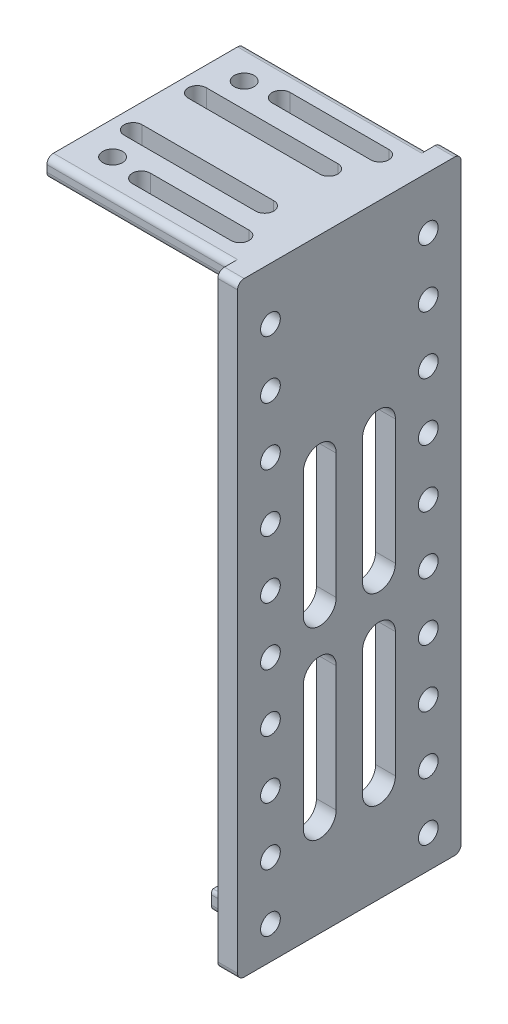
from build123d import *

# Parameters (mm, degrees)
SKETCH_1_W          = 3
SKETCH_1_H          = 34
EXTRUDE_1_DEPTH     = 92
SKETCH_2_W          = 8
SKETCH_2_H          = 20
SKETCH_2_R          = 1.5
EXTRUDE_2_DEPTH     = 3
SKETCH_10_W         = 28
SKETCH_10_H         = 30
SKETCH_10_R         = 1.5
EXTRUDE_6_DEPTH     = 3
EXTRUDE_7_DEPTH     = 1.5
CHAMFER_3_SIZE      = 3
SKETCH_9_R          = 1.5
CUT_EXTRUDE_2_DEPTH = 3
CHAMFER_4_SIZE      = 8
SKETCH_12_R         = 3
CUT_EXTRUDE_3_DEPTH = 17
CUT_EXTRUDE_START   = -3
SKETCH_13_R         = 3
CUT_EXTRUDE_4_DEPTH = 17
FILLET_1_R          = 1
CUT_EXTRUDE_5_DEPTH = 10
CUT_EXTRUDE_6_DEPTH = 10


# Some blends are built 0.0001 mm under size
with BuildPart() as part:
    # 草图1 → 凸台-拉伸1 (new body)
    with BuildSketch(Plane(origin=(0, 0, 0), x_dir=(1, 0, 0), z_dir=(0, 1, 0))):
        with Locations((-10.5, 0)):
            Rectangle(SKETCH_1_W, SKETCH_1_H)
    extrude(amount=EXTRUDE_1_DEPTH)

    # 草图2 → 凸台-拉伸2 (add)
    with BuildSketch(Plane.XZ):
        with Locations((-16, 0)):
            Rectangle(SKETCH_2_W, SKETCH_2_H)
        with Locations(Location((-16, 5, 0), (0, 0, 270))):
            Circle(SKETCH_2_R, mode=Mode.SUBTRACT)
        with Locations(Location((-16, -5, 0), (0, 0, 270))):
            Circle(SKETCH_2_R, mode=Mode.SUBTRACT)
    extrude(amount=-EXTRUDE_2_DEPTH)

    # 草图10 → 凸台-拉伸6 (add)
    with BuildSketch(Plane(origin=(0, 92, 0), x_dir=(1, 0, 0), z_dir=(0, 1, 0))):
        with Locations((-26, 0)):
            Rectangle(SKETCH_10_W, SKETCH_10_H)
        with Locations(Location((-35, 10, 0), (0, 0, 270))):
            Circle(SKETCH_10_R, mode=Mode.SUBTRACT)
        with Locations(Location((-35, -10, 0), (0, 0, 270))):
            Circle(SKETCH_10_R, mode=Mode.SUBTRACT)
    extrude(amount=-EXTRUDE_6_DEPTH)

    # 草图11 → 凸台-拉伸7 (add, symmetric)
    with BuildSketch(Plane.XY):
        Polygon((-12, 69), (-12, 89), (-27, 89), (-15, 69), align=None)
    extrude(amount=EXTRUDE_7_DEPTH, both=True)

    # 倒角3
    chamfer_3_edges = [part.edges().sort_by_distance(p)[0] for p in [
        (-12, 79, -1.5),
        (-12, 69, 0),
        (-12, 79, 1.5),
    ]]
    chamfer(chamfer_3_edges, length=CHAMFER_3_SIZE - 0.0001)  # a hair under: the kernel refuses the full size

    # 草图9 → 切除-拉伸2 (cut)
    with BuildSketch(Plane.ZY.offset(12)):
        with Locations((12, 5)):
            Circle(SKETCH_9_R)
        with Locations((12, 13.777777778)):
            Circle(SKETCH_9_R)
        with Locations((12, 22.555555556)):
            Circle(SKETCH_9_R)
        with Locations((12, 31.333333333)):
            Circle(SKETCH_9_R)
        with Locations((12, 40.111111111)):
            Circle(SKETCH_9_R)
        with Locations((12, 48.888888889)):
            Circle(SKETCH_9_R)
        with Locations((12, 57.666666667)):
            Circle(SKETCH_9_R)
        with Locations((12, 66.444444444)):
            Circle(SKETCH_9_R)
        with Locations((12, 75.222222222)):
            Circle(SKETCH_9_R)
        with Locations((12, 84)):
            Circle(SKETCH_9_R)
        with Locations(Location((-12, 84, 0), (0, 0, 180))):
            Circle(SKETCH_9_R)
        with Locations(Location((-12, 75.222222222, 0), (0, 0, 180))):
            Circle(SKETCH_9_R)
        with Locations(Location((-12, 66.444444444, 0), (0, 0, 180))):
            Circle(SKETCH_9_R)
        with Locations(Location((-12, 57.666666667, 0), (0, 0, 180))):
            Circle(SKETCH_9_R)
        with Locations(Location((-12, 48.888888889, 0), (0, 0, 180))):
            Circle(SKETCH_9_R)
        with Locations(Location((-12, 40.111111111, 0), (0, 0, 180))):
            Circle(SKETCH_9_R)
        with Locations(Location((-12, 31.333333333, 0), (0, 0, 180))):
            Circle(SKETCH_9_R)
        with Locations(Location((-12, 22.555555556, 0), (0, 0, 180))):
            Circle(SKETCH_9_R)
        with Locations(Location((-12, 13.777777778, 0), (0, 0, 180))):
            Circle(SKETCH_9_R)
        with Locations(Location((-12, 5, 0), (0, 0, 180))):
            Circle(SKETCH_9_R)
    extrude(amount=-CUT_EXTRUDE_2_DEPTH, mode=Mode.SUBTRACT)

    # 倒角4
    # the kernel refuses this chamfer: 8 mm, written as the material it adds along each edge
    with BuildSketch(Plane(origin=(-12, 3, 10), x_dir=(0.027495876610586494, 0.9996219169112968, 0), z_dir=(0, 0, -1))) as chamfer_4_piece_1_section:
        Polygon((CHAMFER_4_SIZE * 0.999621916911, -CHAMFER_4_SIZE * 0.0274958766106), (-CHAMFER_4_SIZE * 0.0274958766106, -CHAMFER_4_SIZE * 0.999621916911), (0, 0), align=None)
    chamfer_4_piece_1 = extrude(amount=20, mode=Mode.PRIVATE)
    chamfer_4_piece_1 = split(chamfer_4_piece_1, bisect_by=Plane(origin=(-20, 5.703132101, -1.264e-06), z_dir=(1, 0, 0)), keep=Keep.TOP, mode=Mode.PRIVATE)
    chamfer_4_piece_1 = chamfer_4_piece_1 - Plane(origin=(-16, 5.703132101, 5), x_dir=(0, 0, -1), z_dir=(0, -1, 0)) * Cylinder(1.5, 72, mode=Mode.PRIVATE)
    chamfer_4_piece_1 = chamfer_4_piece_1 - Plane(origin=(-16, 5.703132101, -5), x_dir=(0, 0, -1), z_dir=(0, -1, 0)) * Cylinder(1.5, 72, mode=Mode.PRIVATE)
    add(chamfer_4_piece_1)

    # 草图12 → 切除-拉伸3 (cut)
    with BuildSketch(Plane.ZY.offset(12)):
        with Locations((-12, 5)):
            Circle(SKETCH_12_R)
        with Locations((12, 5)):
            Circle(SKETCH_12_R)
    extrude(amount=CUT_EXTRUDE_3_DEPTH, mode=Mode.SUBTRACT)

    # 草图13 → 切除-拉伸4 (cut)
    with BuildSketch(Plane.XZ.offset(CUT_EXTRUDE_START)):
        with Locations(Location((-16, 5, 0), (0, 0, 270))):
            Circle(SKETCH_13_R)
        with Locations(Location((-16, -5, 0), (0, 0, 270))):
            Circle(SKETCH_13_R)
    extrude(amount=-CUT_EXTRUDE_4_DEPTH, mode=Mode.SUBTRACT)

    # 圆角1
    # the kernel refuses this fillet: 1 mm, written as the material it adds along each edge
    with BuildSketch(Plane(origin=(-10.232233047, 89, -6.267666953), x_dir=(-0.7071067811865476, 0, -0.7071067811865476), z_dir=(-0.7071067811865476, 0, 0.7071067811865476)), Plane(origin=(-10.232233047, 89, 6.267666953), x_dir=(0, -1, 0), z_dir=(-0.7071067811865476, 0, -0.7071067811865476))) as fillet_1_piece_1:
        with BuildLine():
            CenterArc((FILLET_1_R, FILLET_1_R), FILLET_1_R, 180, 90)
            Line((0, FILLET_1_R), (0, 0))
            Line((0, 0), (FILLET_1_R, 0))
        make_face()
    extrude(amount=9.242499266)
    # the kernel refuses this fillet: 1 mm, written as the material it takes off along each edge
    with BuildSketch(Plane(origin=(-12, 0, -10), x_dir=(0, 0, 1), z_dir=(-1, 0, 0)), Plane(origin=(-22.5, 0, 10), x_dir=(0, 0, -1), z_dir=(1, 0, 0))) as fillet_1_2_piece_1:
        with BuildLine():
            CenterArc((FILLET_1_R, FILLET_1_R), FILLET_1_R, 180, 90)
            Line((0, FILLET_1_R), (0, 0))
            Line((0, 0), (FILLET_1_R, 0))
        make_face()
    extrude(amount=10.5, mode=Mode.SUBTRACT)
    with BuildSketch(Plane(origin=(-6.5, 0, -17), x_dir=(0, 1, 0), z_dir=(-1, 0, 0)), Plane(origin=(-6.5, 92, -17), x_dir=(0, 0, 1), z_dir=(-1, 0, 0)), Plane(origin=(-14.5, 92, 17), x_dir=(0, 0, -1), z_dir=(1, 0, 0))) as fillet_1_2_piece_2:
        with BuildLine():
            CenterArc((FILLET_1_R, -FILLET_1_R), FILLET_1_R, 90, 90)
            Line((0, -FILLET_1_R), (0, 0))
            Line((0, 0), (FILLET_1_R, 0))
        make_face()
    extrude(amount=8, mode=Mode.SUBTRACT)
    with BuildSketch(Plane(origin=(-12, 92, -15), x_dir=(0, -1, 0), z_dir=(-1, 0, 0)), Plane(origin=(-12, 89, -15), x_dir=(0, 0, 1), z_dir=(-1, 0, 0)), Plane(origin=(-42.5, 89, 15), x_dir=(0, 0, -1), z_dir=(1, 0, 0))) as fillet_1_2_piece_3:
        with BuildLine():
            CenterArc((FILLET_1_R, FILLET_1_R), FILLET_1_R, 180, 90)
            Line((0, FILLET_1_R), (0, 0))
            Line((0, 0), (FILLET_1_R, 0))
        make_face()
    extrude(amount=30.5, mode=Mode.SUBTRACT)
    with BuildSketch(Plane(origin=(-11.166666667, 65.166766667, -5.333233333), x_dir=(0.4082482904638647, -0.4082482904638616, 0.8164965809277258), z_dir=(-0.5773502691896261, 0.5773502691896254, 0.5773502691896261))) as fillet_1_2_piece_4_section:
        with BuildLine():
            CenterArc((FILLET_1_R * 0.57735026919, FILLET_1_R), FILLET_1_R, 210, 60)
            Line((-FILLET_1_R * 0.288675134595, FILLET_1_R * 0.5), (0, 0))
            Line((0, 0), (FILLET_1_R * 0.57735026919, 0))
        make_face()
    fillet_1_2_piece_4 = extrude(amount=8.082730564, mode=Mode.PRIVATE)
    fillet_1_2_piece_4 = split(fillet_1_2_piece_4, bisect_by=Plane(origin=(-12, 67.52905753, -2.97094247), z_dir=(-1, 0, 0)), keep=Keep.TOP, mode=Mode.PRIVATE)
    fillet_1_2_piece_4 = split(fillet_1_2_piece_4, bisect_by=Plane(origin=(-13.382960945, 67.52905753, -1.5), z_dir=(0, 0, -1)), keep=Keep.TOP, mode=Mode.PRIVATE)
    add(fillet_1_2_piece_4, mode=Mode.SUBTRACT)
    with BuildSketch(Plane(origin=(-11.166666667, 65.166766667, 5.333233333), x_dir=(0.40824829046386624, -0.4082482904638601, -0.8164965809277258), z_dir=(-0.5773502691896261, 0.5773502691896254, -0.5773502691896261))) as fillet_1_2_piece_5_section:
        with BuildLine():
            CenterArc((FILLET_1_R * 0.57735026919, -FILLET_1_R), FILLET_1_R, 90, 60)
            Line((-FILLET_1_R * 0.288675134595, -FILLET_1_R * 0.5), (0, 0))
            Line((0, 0), (FILLET_1_R * 0.57735026919, 0))
        make_face()
    fillet_1_2_piece_5 = extrude(amount=8.082730564, mode=Mode.PRIVATE)
    fillet_1_2_piece_5 = split(fillet_1_2_piece_5, bisect_by=Plane(origin=(-12, 67.52905753, 2.97094247), z_dir=(-1, 0, 0)), keep=Keep.TOP, mode=Mode.PRIVATE)
    fillet_1_2_piece_5 = split(fillet_1_2_piece_5, bisect_by=Plane(origin=(-13.382960945, 67.52905753, 1.5), z_dir=(0, 0, 1)), keep=Keep.TOP, mode=Mode.PRIVATE)
    add(fillet_1_2_piece_5, mode=Mode.SUBTRACT)
    with BuildSketch(Plane(origin=(-42.5, 92, 15), x_dir=(0, 0, -1), z_dir=(1, 0, 0))) as fillet_1_2_piece_6:
        with BuildLine():
            CenterArc((FILLET_1_R, -FILLET_1_R), FILLET_1_R, 90, 90)
            Line((0, -FILLET_1_R), (0, 0))
            Line((0, 0), (FILLET_1_R, 0))
        make_face()
    extrude(amount=30.5, mode=Mode.SUBTRACT)
    with BuildSketch(Plane(origin=(-21.024208334, 2.763932023, 10), x_dir=(0, 0.7095749965325545, -0.7046299200969438), z_dir=(1, 0, 0))) as fillet_1_2_piece_7:
        with BuildLine():
            CenterArc((0.41392887, -0.998250131), FILLET_1_R, 93.390031497, 41.409622109)
            Line((-0.29070105, -0.288675135), (0, 0))
            ThreePointArc((0, 0), (0.177398087, -0.005249607), (0.354796174, 0))
        make_face()
    extrude(amount=9.024208334, mode=Mode.SUBTRACT)
    with BuildSketch(Plane(origin=(-16.788140356, 7.236067977, 10), x_dir=(0, 1, 0), z_dir=(1, 0, 0))) as fillet_1_2_piece_8:
        with BuildLine():
            CenterArc((0.409683334, -1), FILLET_1_R, 90, 41.409622109)
            ThreePointArc((-0.251754494, -0.25), (-0.122178217, -0.12872499), (0, 0))
            Line((0, 0), (0.409683334, 0))
        make_face()
    extrude(amount=4.788140356, mode=Mode.SUBTRACT)
    with BuildSketch(Plane(origin=(-10.232233047, 12.767766953, 10), x_dir=(0, 0, -1), z_dir=(-0.7071067811868302, -0.7071067811862649, 0))) as fillet_1_2_piece_9_section:
        with BuildLine():
            CenterArc((FILLET_1_R, FILLET_1_R), FILLET_1_R, 180, 90)
            Line((0, FILLET_1_R), (0, 0))
            Line((0, 0), (FILLET_1_R, 0))
        make_face()
    fillet_1_2_piece_9 = extrude(amount=10.323003714, mode=Mode.PRIVATE)
    fillet_1_2_piece_9 = split(fillet_1_2_piece_9, bisect_by=Plane(origin=(-12, 8.839090903, 9.756601608), z_dir=(-1, 0, 0)), keep=Keep.TOP, mode=Mode.PRIVATE)
    add(fillet_1_2_piece_9, mode=Mode.SUBTRACT)
    with BuildSketch(Plane(origin=(-10.232233047, 12.767766953, -10), x_dir=(0, 0, 1), z_dir=(-0.7071067811868302, -0.7071067811862649, 0))) as fillet_1_2_piece_10_section:
        with BuildLine():
            CenterArc((FILLET_1_R, -FILLET_1_R), FILLET_1_R, 90, 90)
            Line((0, -FILLET_1_R), (0, 0))
            Line((0, 0), (FILLET_1_R, 0))
        make_face()
    fillet_1_2_piece_10 = extrude(amount=10.323003714, mode=Mode.PRIVATE)
    fillet_1_2_piece_10 = split(fillet_1_2_piece_10, bisect_by=Plane(origin=(-12, 8.839097768, -9.756602102), z_dir=(-1, 0, 0)), keep=Keep.TOP, mode=Mode.PRIVATE)
    add(fillet_1_2_piece_10, mode=Mode.SUBTRACT)
    with BuildSketch(Plane(origin=(-16.788140356, 7.236067977, -10), x_dir=(0, 1, 0), z_dir=(1, 0, 0))) as fillet_1_2_piece_11:
        with BuildLine():
            CenterArc((0.409683334, 1), FILLET_1_R, 228.590377891, 41.409622109)
            ThreePointArc((-0.251754494, 0.25), (-0.122178217, 0.12872499), (0, 0))
            Line((0, 0), (0.409683334, 0))
        make_face()
    extrude(amount=4.788140356, mode=Mode.SUBTRACT)
    with BuildSketch(Plane(origin=(-21.024208334, 2.763932023, -10), x_dir=(0, 0.7095749965325564, 0.7046299200969418), z_dir=(1, 0, 0))) as fillet_1_2_piece_12:
        with BuildLine():
            CenterArc((0.41392887, 0.998250131), FILLET_1_R, 225.200346393, 41.409622109)
            Line((-0.29070105, 0.288675135), (0, 0))
            ThreePointArc((0, 0), (0.177398087, 0.005249607), (0.354796174, 0))
        make_face()
    extrude(amount=9.024208334, mode=Mode.SUBTRACT)
    with BuildSketch(Plane(origin=(-14.5, 0, 17), x_dir=(0, 0, -1), z_dir=(1, 0, 0))) as fillet_1_2_piece_13:
        with BuildLine():
            CenterArc((FILLET_1_R, FILLET_1_R), FILLET_1_R, 180, 90)
            Line((0, FILLET_1_R), (0, 0))
            Line((0, 0), (FILLET_1_R, 0))
        make_face()
    extrude(amount=8, mode=Mode.SUBTRACT)

    # 草图14 → 切除-拉伸5 (cut)
    with BuildSketch(Plane.ZY.offset(12)):
        with BuildLine():
            Line((-2, 34), (-2, 15))
            ThreePointArc((-2, 15), (-4.5, 12.5), (-7, 15))
            Line((-7, 15), (-7, 34))
            ThreePointArc((-7, 34), (-4.5, 36.5), (-2, 34))
        make_face()
        with BuildLine():
            Line((7, 34), (7, 15))
            ThreePointArc((7, 15), (4.5, 12.5), (2, 15))
            Line((2, 15), (2, 34))
            ThreePointArc((2, 34), (4.5, 36.5), (7, 34))
        make_face()
        with BuildLine():
            Line((-2, 43), (-2, 62))
            ThreePointArc((-2, 62), (-4.5, 64.5), (-7, 62))
            Line((-7, 62), (-7, 43))
            ThreePointArc((-7, 43), (-4.5, 40.5), (-2, 43))
        make_face()
        with BuildLine():
            Line((7, 43), (7, 62))
            ThreePointArc((7, 62), (4.5, 64.5), (2, 62))
            Line((2, 62), (2, 43))
            ThreePointArc((2, 43), (4.5, 40.5), (7, 43))
        make_face()
    extrude(amount=-CUT_EXTRUDE_5_DEPTH, mode=Mode.SUBTRACT)

    # 草图15 → 切除-拉伸6 (cut)
    with BuildSketch(Plane.XZ.offset(-89)):
        with BuildLine():
            Line((-30, 12), (-15, 12))
            ThreePointArc((-15, 12), (-13.625, 10.625), (-15, 9.25))
            Line((-15, 9.25), (-30, 9.25))
            ThreePointArc((-30, 9.25), (-31.375, 10.625), (-30, 12))
        make_face()
        with BuildLine():
            Line((-37, 6.25), (-17, 6.25))
            ThreePointArc((-17, 6.25), (-15.625, 4.875), (-17, 3.5))
            Line((-17, 3.5), (-37, 3.5))
            ThreePointArc((-37, 3.5), (-38.375, 4.875), (-37, 6.25))
        make_face()
        with BuildLine():
            Line((-30, -12), (-15, -12))
            ThreePointArc((-15, -12), (-13.625, -10.625), (-15, -9.25))
            Line((-15, -9.25), (-30, -9.25))
            ThreePointArc((-30, -9.25), (-31.375, -10.625), (-30, -12))
        make_face()
        with BuildLine():
            Line((-37, -6.25), (-17, -6.25))
            ThreePointArc((-17, -6.25), (-15.625, -4.875), (-17, -3.5))
            Line((-17, -3.5), (-37, -3.5))
            ThreePointArc((-37, -3.5), (-38.375, -4.875), (-37, -6.25))
        make_face()
    extrude(amount=-CUT_EXTRUDE_6_DEPTH, mode=Mode.SUBTRACT)


solid = part.part
